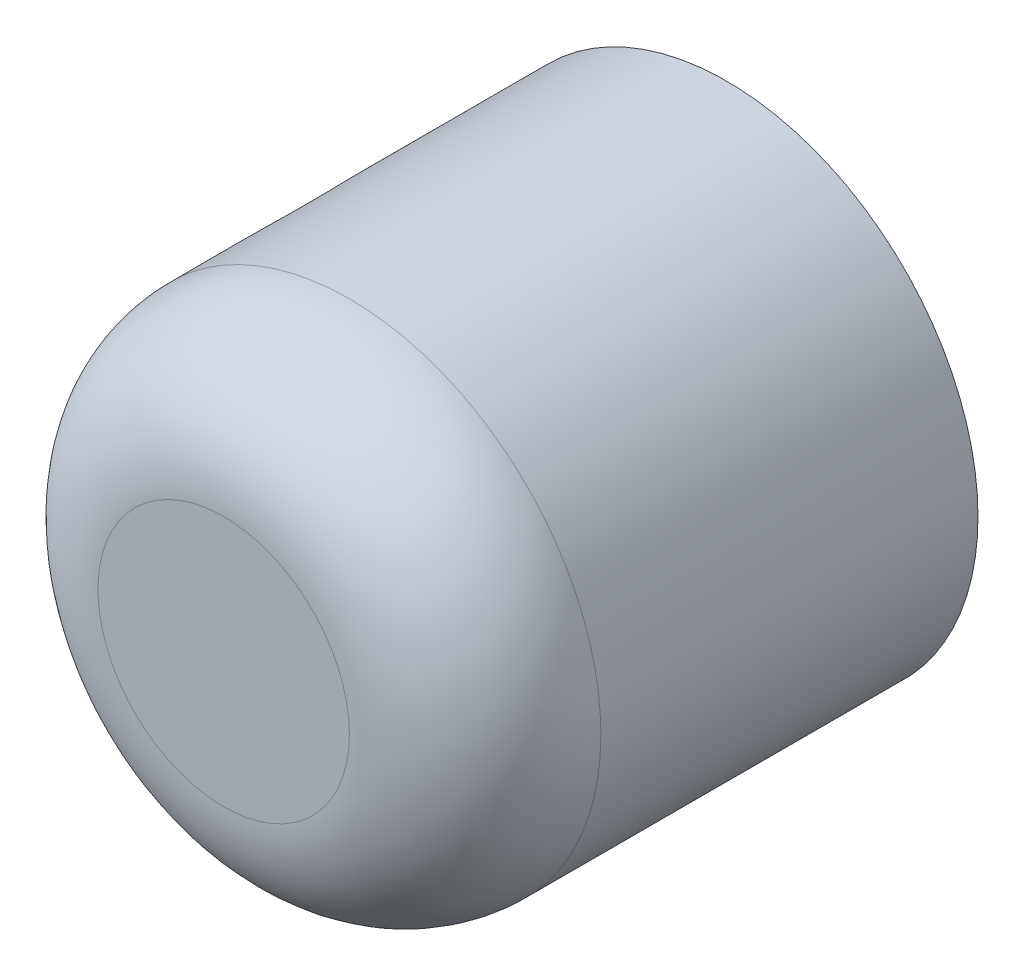
from build123d import *

# Parameters (mm, degrees)
SKETCH1_R           = 20
BOSS_EXTRUDE1_DEPTH = 40
SKETCH2_R           = 15
CUT_EXTRUDE1_DEPTH  = 25
FILLET1_R           = 10


with BuildPart() as part:
    # Sketch1 → Boss-Extrude1 (new body)
    with BuildSketch(Plane.XY):
        Circle(SKETCH1_R)
    extrude(amount=BOSS_EXTRUDE1_DEPTH)

    # Sketch2 → Cut-Extrude1 (cut)
    with BuildSketch(Plane.ZY.offset(20)):
        with Locations((20, 0)):
            Circle(SKETCH2_R)
    extrude(amount=-CUT_EXTRUDE1_DEPTH, mode=Mode.SUBTRACT)

    # Fillet1
    # the kernel refuses this fillet: 10 mm, written as the material it takes off along each edge
    with BuildSketch(Plane(origin=(0, 0, 40), x_dir=(1, 0, 0), z_dir=(0, -1, 0))) as fillet1_piece_1:
        with BuildLine():
            CenterArc((20 - FILLET1_R, -FILLET1_R), FILLET1_R, 0, 90)
            Line((20 - FILLET1_R, 0), (20, 0))
            Line((20, 0), (20, -FILLET1_R))
        make_face()
    revolve(axis=Axis((0, 0, 40), (0, 0, 1)), mode=Mode.SUBTRACT)


solid = part.part
